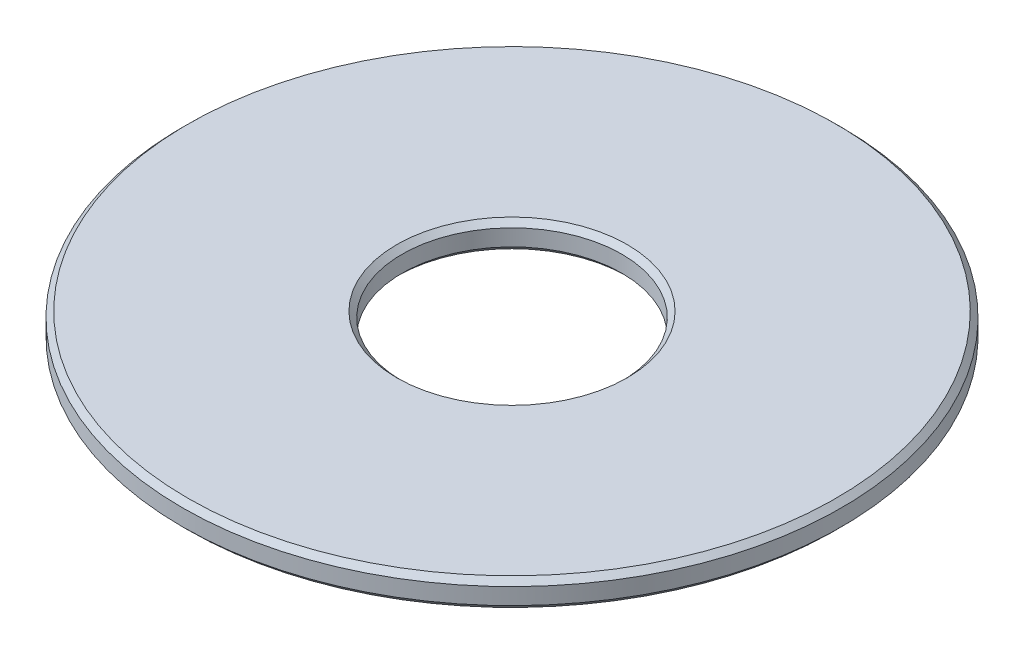
from build123d import *

# Parameters (mm, degrees)
SKETCH1_R           = 6
SKETCH1_R_2         = 2
BOSS_EXTRUDE1_DEPTH = 0.5
CHAMFER1_SIZE       = 0.1


with BuildPart() as part:
    # Sketch1 → Boss-Extrude1 (new body)
    with BuildSketch(Plane(origin=(0, 0, 0), x_dir=(1, 0, 0), z_dir=(0, 1, 0))):
        Circle(SKETCH1_R)
        Circle(SKETCH1_R_2, mode=Mode.SUBTRACT)
    extrude(amount=BOSS_EXTRUDE1_DEPTH)

    # Chamfer1
    chamfer1_edges = [part.edges().sort_by_distance(p)[0] for p in [
        (-2, 0, 0),
        (-6, 0, 0),
        (-2, 0.5, 0),
        (-6, 0.5, 0),
    ]]
    chamfer(chamfer1_edges, length=CHAMFER1_SIZE)


solid = part.part
